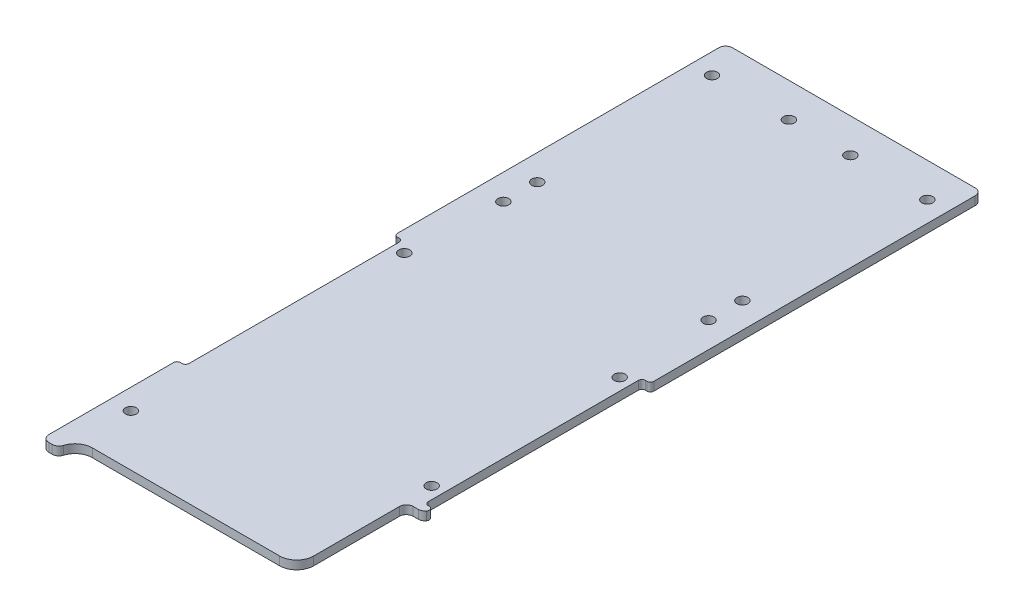
from build123d import *

# Parameters (mm, degrees)
SKETCH1_R               = 2.032
BOSS_EXTRUDE1_DEPTH     = 3.175
FILLET1_R               = 2.54
FILLET2_R               = 2.54
FILLET3_R               = 6.35
CUT_EXTRUDE1_DEPTH      = 136.673215063
FILLET4_R               = 6.35
FILLET5_R               = 2.54
SKETCH3_R               = 2.032
CUT_EXTRUDE2_DEPTH      = 136.673215063
CUT_EXTRUDE3_DEPTH      = 136.673215063
CUT_EXTRUDE3_DEPTH_BACK = 136.673215063
SKETCH4_W               = 3.175
SKETCH4_H               = 80.645
FILLET6_R               = 1.27


with BuildPart() as part:
    # Sketch1 → Boss-Extrude1 (new body)
    with BuildSketch(Plane(origin=(0, 0, 0), x_dir=(1, 0, 0), z_dir=(0, 1, 0))):
        Polygon((47.625, 127), (-47.625, 127), (-47.625, -127), (-41.275, -127), (-41.275, -120.65), (41.275, -120.65), (41.275, -127), (47.625, -127), align=None)
        with Locations((-39.999684148, -101.6)):
            Circle(SKETCH1_R, mode=Mode.SUBTRACT)
        with Locations((39.999684148, -69.85)):
            Circle(SKETCH1_R, mode=Mode.SUBTRACT)
        with Locations((-39.999684148, 0)):
            Circle(SKETCH1_R, mode=Mode.SUBTRACT)
        with Locations((-39.999684148, 114.3)):
            Circle(SKETCH1_R, mode=Mode.SUBTRACT)
        with Locations((-11.424684148, 114.3)):
            Circle(SKETCH1_R, mode=Mode.SUBTRACT)
        with Locations((39.999684148, 0)):
            Circle(SKETCH1_R, mode=Mode.SUBTRACT)
        with Locations((11.424684148, 114.3)):
            Circle(SKETCH1_R, mode=Mode.SUBTRACT)
        with Locations((39.999684148, 114.3)):
            Circle(SKETCH1_R, mode=Mode.SUBTRACT)
    extrude(amount=BOSS_EXTRUDE1_DEPTH)

    # Fillet1
    fillet1_edges = [part.edges().sort_by_distance(p)[0] for p in [
        (-47.625, 1.5875, -127),
        (47.625, 1.5875, -127),
        (47.625, 1.5875, 127),
        (-47.625, 1.5875, 127),
    ]]
    fillet(fillet1_edges, radius=FILLET1_R)

    # Fillet2
    fillet2_edges = [part.edges().sort_by_distance(p)[0] for p in [
        (41.275, 1.5875, 127),
        (-41.275, 1.5875, 127),
    ]]
    fillet(fillet2_edges, radius=FILLET2_R)

    # Fillet3
    fillet3_edges = [part.edges().sort_by_distance(p)[0] for p in [
        (41.275, 1.5875, 120.65),
        (-41.275, 1.5875, 120.65),
    ]]
    fillet(fillet3_edges, radius=FILLET3_R)

    # Sketch2 → Cut-Extrude1 (cut, through all)
    with BuildSketch(Plane.XZ):
        with BuildLine():
            Line((40.64508, 123.578690235), (40.64508, 79.88808))
            Line((40.64508, 79.88808), (47.625, 79.88808))
            Line((47.625, 79.88808), (47.625, 124.46))
            ThreePointArc((47.625, 124.46), (46.881051224, 126.256051224), (45.085, 127))
            Line((45.085, 127), (43.815, 127))
            ThreePointArc((43.815, 127), (42.297059666, 126.496530663), (41.380880287, 125.185714286))
            ThreePointArc((41.380880287, 125.185714286), (41.069166069, 124.356476684), (40.64508, 123.578690235))
        make_face()
    extrude(amount=-CUT_EXTRUDE1_DEPTH, mode=Mode.SUBTRACT)

    # Fillet4
    fillet4_edges = [part.edges().sort_by_distance(p)[0] for p in [
        (40.64508, 1.5875, 123.578690235),
    ]]
    fillet(fillet4_edges, radius=FILLET4_R)

    # Fillet5
    fillet5_edges = [part.edges().sort_by_distance(p)[0] for p in [
        (47.625, 1.5875, 79.88808),
        (40.64508, 1.5875, 79.88808),
    ]]
    fillet(fillet5_edges, radius=FILLET5_R)

    # Sketch3 → Cut-Extrude2 (cut, through all)
    with BuildSketch(Plane.XZ):
        with Locations((-38.106582434, -34.913768806)):
            Circle(SKETCH3_R)
        with Locations((-38.106582434, -47.490173279)):
            Circle(SKETCH3_R)
        with Locations((38.106582434, -47.490173279)):
            Circle(SKETCH3_R)
        with Locations((38.106582434, -34.913768806)):
            Circle(SKETCH3_R)
    extrude(amount=-CUT_EXTRUDE2_DEPTH, mode=Mode.SUBTRACT)

    # Sketch4 → Cut-Extrude3 (cut, two sides: drawn at the far end of the back side and taken through both)
    with BuildSketch(Plane(origin=(0, 3.175, 0), x_dir=(1, 0, 0), z_dir=(0, 1, 0)).offset(-CUT_EXTRUDE3_DEPTH_BACK)):
        with Locations((-46.0375, -36.5125)):
            Rectangle(SKETCH4_W, SKETCH4_H)
        with Locations((46.0375, -36.5125)):
            Rectangle(SKETCH4_W, SKETCH4_H)
    extrude(amount=CUT_EXTRUDE3_DEPTH + CUT_EXTRUDE3_DEPTH_BACK, mode=Mode.SUBTRACT)

    # Fillet6
    fillet6_edges = [part.edges().sort_by_distance(p)[0] for p in [
        (-44.45, 1.5875, -3.81),
        (-47.625, 1.5875, -3.81),
        (-47.625, 1.5875, 76.835),
        (-44.45, 1.5875, 76.835),
        (44.45, 1.5875, 76.835),
        (47.625, 1.5875, 76.835),
        (44.45, 1.5875, -3.81),
        (47.625, 1.5875, -3.81),
    ]]
    fillet(fillet6_edges, radius=FILLET6_R)


solid = part.part
